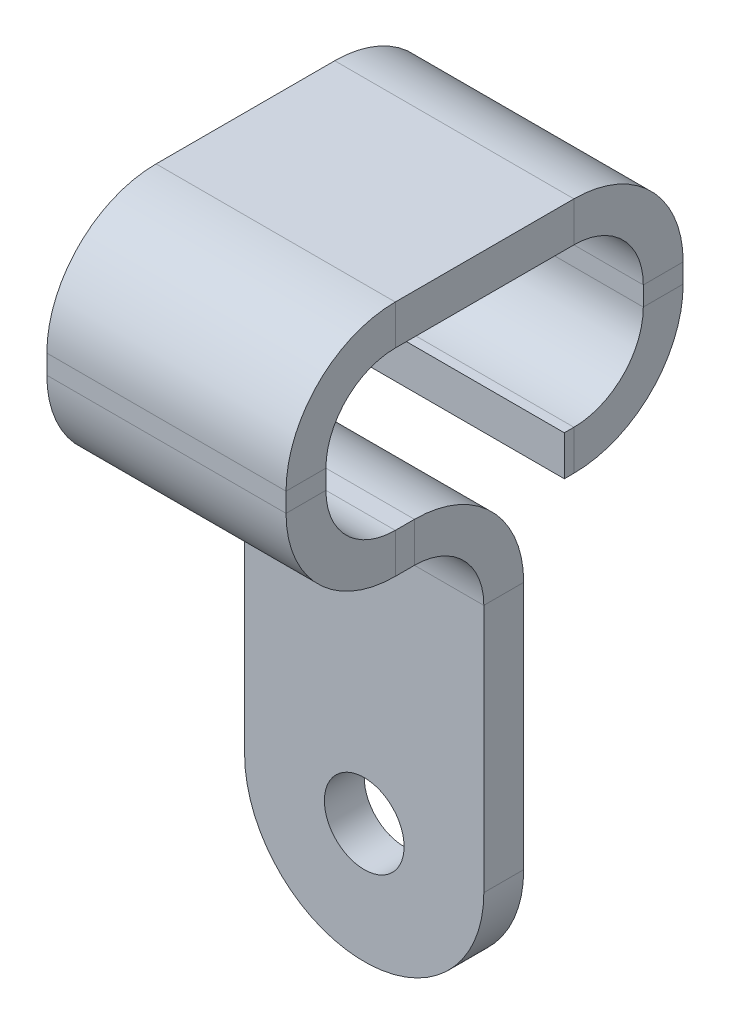
from build123d import *

# Parameters (mm, degrees)
EXTRUDE_1_DEPTH     = 1
SKETCH_2_R          = 1
CUT_EXTRUDE_1_DEPTH = 28.116287625
OTHER_START         = -3
OTHER_1_DEPTH       = 6
OTHER_1_2_DEPTH     = 6
OTHER_2_DEPTH       = 6
OTHER_2_2_DEPTH     = 6
OTHER_START_2       = -5.911973487
OTHER_2_3_OUTLINE_W = 6
OTHER_2_3_OUTLINE_H = 4
OTHER_2_3_DEPTH     = 12.911973487
OTHER_START_3       = -10.873389715
OTHER_2_4_OUTLINE_R = 1
OTHER_2_4_DEPTH     = 1
OTHER_START_4       = -8.133389715
OTHER_2_5_OUTLINE_W = 6
OTHER_2_5_OUTLINE_H = 1
OTHER_2_5_DEPTH     = 0.481416228
OTHER_2_6_DEPTH     = 6
OTHER_2_7_DEPTH     = 6


with BuildPart() as part:
    # Sketch 1 → Бобышка-Вытянуть1 (new body)
    with BuildSketch(Plane(origin=(0, 0, 0), x_dir=(1, 0, 0), z_dir=(0, 1, 0))):
        with BuildLine():
            Line((-3, 26.931265373), (-3, -3.068734627))
            ThreePointArc((-3, -3.068734627), (0, -6.068734627), (3, -3.068734627))
            Line((3, -3.068734627), (3, 26.931265373))
            Line((3, 26.931265373), (-3, 26.931265373))
        make_face()
    extrude(amount=EXTRUDE_1_DEPTH)

    # Sketch 2 → Вырез-Вытянуть1 (cut, through all)
    with BuildSketch(Plane(origin=(0, 1, 0), x_dir=(1, 0, 0), z_dir=(0, 1, 0))):
        with Locations(Location((0, -3.068734627, 0), (0, 0, 270))):
            Circle(SKETCH_2_R)
    extrude(amount=-CUT_EXTRUDE_1_DEPTH, mode=Mode.SUBTRACT)

    # Other 1: read off the stored shape, not the designer's step
    # Other 1 outline → Other 1 (cut)
    with BuildSketch(Plane.YZ.offset(OTHER_START)):
        with BuildLine():
            Line((1, -26.931265373), (1, -5.288574535))
            ThreePointArc((1, -5.288574535), (0.26258199, -4.342443478), (0, -3.171973487))
            Line((0, -3.171973487), (0, -26.931265373))
            Line((0, -26.931265373), (1, -26.931265373))
        make_face()
    extrude(amount=OTHER_1_DEPTH, mode=Mode.SUBTRACT)

    # Other 1 2 outline → Other 1 2 (add)
    with BuildSketch(Plane.YZ.offset(OTHER_START)):
        with BuildLine():
            Line((2.74, -5.911973487), (22.980708114, -5.911973487))
            Line((22.980708114, -5.911973487), (22.980708114, -4.911973487))
            Line((22.980708114, -4.911973487), (2.74, -4.911973487))
            ThreePointArc((2.74, -4.911973487), (1.509634201, -4.402339286), (1, -3.171973487))
            Line((1, -3.171973487), (1, -5.288574535))
            ThreePointArc((1, -5.288574535), (1.815848193, -5.75141983), (2.74, -5.911973487))
        make_face()
    extrude(amount=OTHER_1_2_DEPTH)

    # Other 2: read off the stored shape, not the designer's step
    # Other 2 outline → Other 2 (cut)
    with BuildSketch(Plane.YZ.offset(OTHER_START)):
        with BuildLine():
            ThreePointArc((7.221416228, -4.911973487), (8.391886219, -5.174555476), (9.338017277, -5.911973487))
            Line((9.338017277, -5.911973487), (22.980708114, -5.911973487))
            Line((22.980708114, -5.911973487), (22.980708114, -4.911973487))
            Line((22.980708114, -4.911973487), (7.221416228, -4.911973487))
        make_face()
    extrude(amount=OTHER_2_DEPTH, mode=Mode.SUBTRACT)

    # Other 2 2 outline → Other 2 2 (add)
    with BuildSketch(Plane.YZ.offset(OTHER_START)):
        with BuildLine():
            Line((8.961416228, -7.651973487), (8.961416228, -12.133389715))
            ThreePointArc((8.961416228, -12.133389715), (8.451782027, -13.363755514), (7.221416228, -13.873389715))
            Line((7.221416228, -13.873389715), (6.74, -13.873389715))
            ThreePointArc((6.74, -13.873389715), (5.509634201, -13.363755514), (5, -12.133389715))
            Line((5, -12.133389715), (5, -11.892681601))
            Line((5, -11.892681601), (4, -11.892681601))
            Line((4, -11.892681601), (4, -12.133389715))
            ThreePointArc((4, -12.133389715), (4.80252742, -14.070862295), (6.74, -14.873389715))
            Line((6.74, -14.873389715), (7.221416228, -14.873389715))
            ThreePointArc((7.221416228, -14.873389715), (9.158888808, -14.070862295), (9.961416228, -12.133389715))
            Line((9.961416228, -12.133389715), (9.961416228, -7.651973487))
            ThreePointArc((9.961416228, -7.651973487), (9.800862571, -6.72782168), (9.338017277, -5.911973487))
            Line((9.338017277, -5.911973487), (7.221416228, -5.911973487))
            ThreePointArc((7.221416228, -5.911973487), (8.451782028, -6.421607687), (8.961416228, -7.651973487))
        make_face()
    extrude(amount=OTHER_2_2_DEPTH)

    # Other 2 3 outline → Other 2 3 (cut)
    with BuildSketch(Plane.XY.offset(OTHER_START_2)):
        with Locations((0, 2)):
            Rectangle(OTHER_2_3_OUTLINE_W, OTHER_2_3_OUTLINE_H)
    extrude(amount=OTHER_2_3_DEPTH, mode=Mode.SUBTRACT)

    # Other 2 6 outline → Other 2 6 (cut)
    with BuildSketch(Plane.YZ.offset(OTHER_START)):
        with BuildLine():
            ThreePointArc((4.623398951, -5.911973487), (5.569530009, -5.174555476), (6.74, -4.911973487))
            Line((6.74, -4.911973487), (4, -4.911973487))
            Line((4, -4.911973487), (4, -5.911973487))
            Line((4, -5.911973487), (4.623398951, -5.911973487))
        make_face()
    extrude(amount=OTHER_2_6_DEPTH, mode=Mode.SUBTRACT)



with BuildPart() as body_2:
    # Other 2 4 outline → Other 2 4 (new body)
    with BuildSketch(Plane.XY.offset(OTHER_START_3)):
        with BuildLine():
            Line((3, 1), (-3, 1))
            Line((-3, 1), (-3, -3.980708114))
            ThreePointArc((-3, -3.980708114), (0, -6.980708114), (3, -3.980708114))
            Line((3, -3.980708114), (3, 1))
        make_face()
        with Locations((0, -3.980708114)):
            Circle(OTHER_2_4_OUTLINE_R, mode=Mode.SUBTRACT)
    extrude(amount=OTHER_2_4_DEPTH)


with BuildPart() as body_3:
    # Other 2 5 outline → Other 2 5 (new body)
    with BuildSketch(Plane.XY.offset(OTHER_START_4)):
        with Locations((0, 4.5)):
            Rectangle(OTHER_2_5_OUTLINE_W, OTHER_2_5_OUTLINE_H)
    extrude(amount=OTHER_2_5_DEPTH)


with BuildPart() as part_1:
    add(part.part)

    add(body_2.part)  # Other 2 7 merges body 2

    add(body_3.part)  # Other 2 7 merges body 3
    # Other 2 7 outline → Other 2 7 (add)
    with BuildSketch(Plane.YZ.offset(OTHER_START)):
        with BuildLine():
            Line((6.74, -5.911973487), (4.623398951, -5.911973487))
            ThreePointArc((4.623398951, -5.911973487), (4.160553657, -6.72782168), (4, -7.651973487))
            Line((4, -7.651973487), (5, -7.651973487))
            ThreePointArc((5, -7.651973487), (5.5096342, -6.421607687), (6.74, -5.911973487))
        make_face()
        with BuildLine():
            Line((1, -10.873389715), (2.26, -10.873389715))
            ThreePointArc((2.26, -10.873389715), (4.19747258, -10.070862295), (5, -8.133389715))
            Line((5, -8.133389715), (4, -8.133389715))
            ThreePointArc((4, -8.133389715), (3.490365799, -9.363755514), (2.26, -9.873389715))
            Line((2.26, -9.873389715), (1, -9.873389715))
            Line((1, -9.873389715), (1, -10.873389715))
        make_face()
    extrude(amount=OTHER_2_7_DEPTH)


solid = part_1.part
